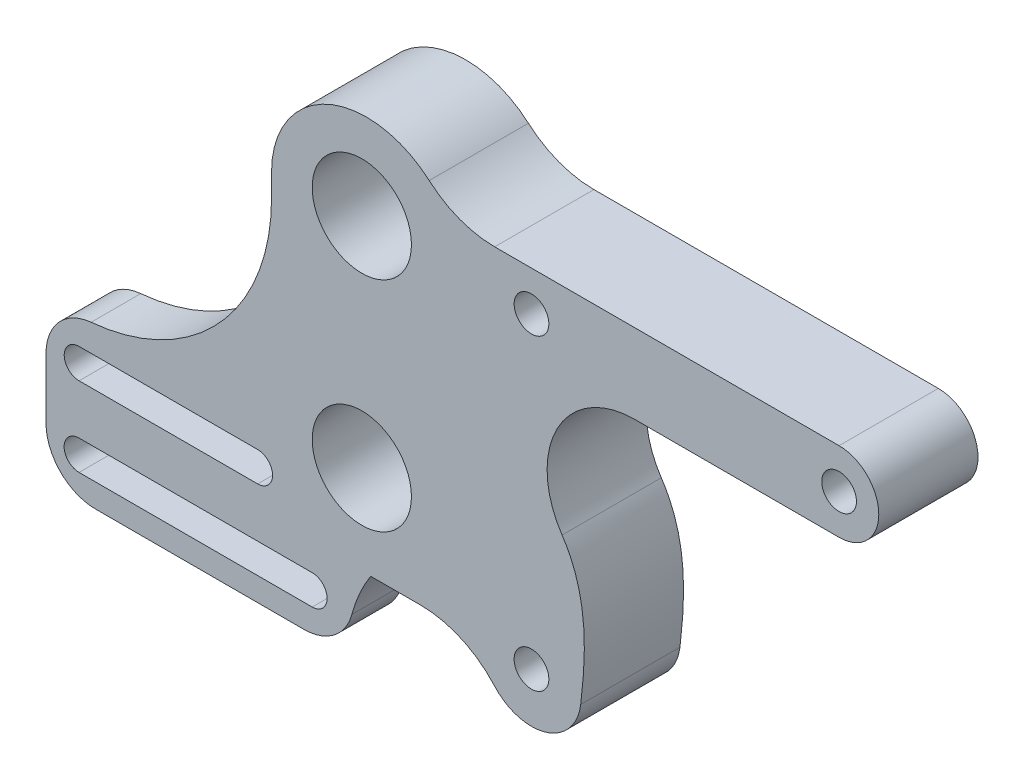
from build123d import *

# Parameters (mm, degrees)
SKETCH1_R           = 1.75
SKETCH1_R_2         = 5
BOSS_EXTRUDE1_DEPTH = 10
EXTRUDE1_DEPTH      = 5
FILLET2_R           = 20
FILLET3_R           = 5
FILLET5_R           = 5
EXTRUDE2_DEPTH      = 5
FILLET7_R           = 475
FILLET8_R           = 15
FILLET9_R           = 5
SKETCH4_R           = 3.5
EXTRUDE3_DEPTH      = 1


with BuildPart() as part:
    # Sketch1 → Boss-Extrude1 (new body)
    with BuildSketch(Plane.XY):
        with BuildLine():
            Line((59.115327383, 43.551262968), (93.822811009, 43.551262968))
            ThreePointArc((93.822811009, 43.551262968), (97.822811009, 39.551262968), (93.822811009, 35.551262968))
            Line((93.822811009, 35.551262968), (73.221068218, 35.551262968))
            ThreePointArc((73.221068218, 35.551262968), (65.430500205, 30.870379763), (65.905746743, 21.794160382))
            add(Edge.make_bspline(
                [(65.905746743, 21.794160382), (68.510586107, 17.931817085), (68.397648351, 12.955422289), (67.785956814, 7.945306105)],
                knots=[0, 0, 0, 0, 1, 1, 1, 1], degree=3))
            ThreePointArc((67.785956814, 7.945306105), (67.117243875, 5.990433735), (65.715264602, 4.47281814))
            ThreePointArc((65.715264602, 4.47281814), (62.263505272, 3.582643734), (59.096031047, 5.217929635))
            ThreePointArc((59.096031047, 5.217929635), (55.724954026, 7.67997226), (51.642471122, 8.551262968))
            Line((51.642471122, 8.551262968), (46.626949913, 8.551262968))
            ThreePointArc((46.626949913, 8.551262968), (39.555882101, 11.480195156), (36.626949913, 18.551262968))
            Line((36.626949913, 18.551262968), (36.626949913, 38.848632096))
            ThreePointArc((36.626949913, 38.848632096), (42.251881835, 47.568318218), (52.515088487, 46.03881686))
            ThreePointArc((52.515088487, 46.03881686), (55.588605185, 44.19379373), (59.115327383, 43.551262968))
        make_face()
        with Locations((93.822811009, 39.551262968)):
            Circle(SKETCH1_R, mode=Mode.SUBTRACT)
        with Locations((62.822811009, 39.551262968)):
            Circle(SKETCH1_R, mode=Mode.SUBTRACT)
        with Locations((62.822811009, 8.551262968)):
            Circle(SKETCH1_R, mode=Mode.SUBTRACT)
        with Locations((45.725055781, 39.551262968)):
            Circle(SKETCH1_R_2, mode=Mode.SUBTRACT)
        with Locations((45.725055781, 17.551264875)):
            Circle(SKETCH1_R_2, mode=Mode.SUBTRACT)
    extrude(amount=-BOSS_EXTRUDE1_DEPTH)

    # Sketch2 → Extrude1 (add)
    with BuildSketch(Plane.XY):
        Polygon((45.636633265, 8.551262968), (43.896905309, 0.551262968), (13.896905309, 0.551262968), (13.896905309, 16.551262968), (39.149006125, 16.551262968), (41.006428166, 12.551262968), (45.636633265, 10.857586925), align=None)
    extrude(amount=-EXTRUDE1_DEPTH)

    # Fillet2
    # the kernel refuses this fillet: 20 mm, written as the material it adds along each edge
    with BuildSketch(Plane(origin=(36.828990942, 16.551262968, -5), x_dir=(-0.010101536018348446, 0.9999489781834221, 0), z_dir=(0, 0, 1))) as fillet2_piece_1:
        with BuildLine():
            CenterArc((20.203051209, 19.998979564), FILLET2_R, 179.421214776, 90)
            Line((0.204071645, 20.201010284), (-1.795826311, 20.221213356))
            Line((-1.795826311, 20.221213356), (-1.999897956, 0.020203072))
            Line((-1.999897956, 0.020203072), (0.380184704, -1.963532427))
            ThreePointArc((0.380184704, -1.963532427), (1.981735809, -1.818070308), (19.980817416, -1.999897956))
            Line((19.980817416, -1.999897956), (20.001020488, 0))
        make_face()
    extrude(amount=5)

    # Fillet3
    fillet3_edges = [part.edges().sort_by_distance(p)[0] for p in [
        (13.896905309, 16.551262968, -2.5),
    ]]
    fillet(fillet3_edges, radius=FILLET3_R)

    # Fillet5
    fillet5_edges = [part.edges().sort_by_distance(p)[0] for p in [
        (13.896905309, 0.551262968, -2.5),
    ]]
    fillet(fillet5_edges, radius=FILLET5_R)

    # Sketch3 → Extrude2 (cut)
    with BuildSketch(Plane(origin=(0, 0, -5), x_dir=(-1, 0, 0), z_dir=(0, 0, -1))):
        with BuildLine():
            Line((-17.230767467, 10.918134064), (-35.230767467, 10.918134064))
            ThreePointArc((-35.230767467, 10.918134064), (-36.730767467, 12.418134064), (-35.230767467, 13.918134064))
            Line((-35.230767467, 13.918134064), (-17.230767467, 13.918134064))
            ThreePointArc((-17.230767467, 13.918134064), (-15.730767467, 12.418134064), (-17.230767467, 10.918134064))
        make_face()
        with BuildLine():
            Line((-17.225055781, 2.918134064), (-40.725055781, 2.918134064))
            ThreePointArc((-40.725055781, 2.918134064), (-42.225055781, 4.418134064), (-40.725055781, 5.918134064))
            Line((-40.725055781, 5.918134064), (-17.225055781, 5.918134064))
            ThreePointArc((-17.225055781, 5.918134064), (-15.725055781, 4.418134064), (-17.225055781, 2.918134064))
        make_face()
    extrude(amount=-EXTRUDE2_DEPTH, mode=Mode.SUBTRACT)

    # Fillet7
    # the kernel refuses this fillet: 475 mm, written as the material it adds along each edge
    with BuildSketch(Plane(origin=(45.636633265, 8.600420143, -5), x_dir=(0, -1, 0), z_dir=(0, 0, 1))) as fillet7_piece_1:
        with BuildLine():
            CenterArc((475.04890177, 0.492579304), FILLET7_R, 179.941199476, 0.118216777)
            ThreePointArc((0.049151908, 0.980054022), (0.036604611, 0.489423747), (0, 0))
            Line((0, 0), (0.049157175, 0))
        make_face()
    extrude(amount=5)

    # Fillet8
    # the kernel refuses this fillet: 15 mm, written as the material it adds along each edge
    with BuildSketch(Plane(origin=(45.636633265, 8.551262968, 0), x_dir=(0.999999999985564, 5.37325013854713e-06, 0), z_dir=(0, 0, -1))) as fillet8_piece_1:
        with BuildLine():
            CenterArc((13.580951994, 8.137405625), FILLET8_R, 192.269167845, 20.584390422)
            Line((-1.076449047, 4.949836848), (0, 0))
            ThreePointArc((0, 0), (0.490027011, -0.000252765), (0.980054022, 0))
        make_face()
    extrude(amount=5)

    # Fillet9
    fillet9_edges = [part.edges().sort_by_distance(p)[0] for p in [
        (43.896905309, 0.551262968, -2.5),
    ]]
    fillet(fillet9_edges, radius=FILLET9_R)

    # Sketch4 → Extrude3 (cut)
    with BuildSketch(Plane(origin=(0, 0, -10), x_dir=(-1, 0, 0), z_dir=(0, 0, -1))):
        with Locations((-62.822811009, 39.551262968)):
            Circle(SKETCH4_R)
        with Locations((-93.822811009, 39.551262968)):
            Circle(SKETCH4_R)
        with Locations((-62.822811009, 8.551262968)):
            Circle(SKETCH4_R)
    extrude(amount=-EXTRUDE3_DEPTH, mode=Mode.SUBTRACT)


solid = part.part
